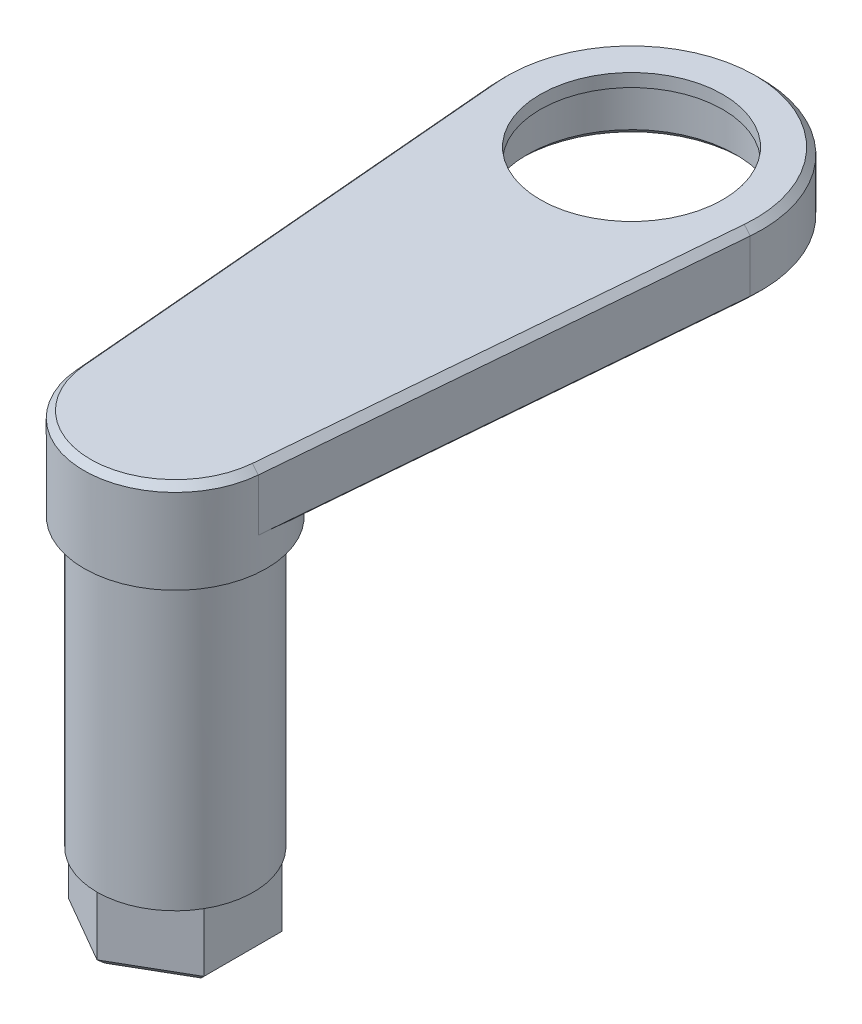
from build123d import *

# Parameters (mm, degrees)
BOSS_EXTRUDE3_DEPTH = 5
BOSS_EXTRUDE1_START = 5
SKETCH2_R           = 8
BOSS_EXTRUDE1_DEPTH = 5
SKETCH3_R           = 8
SKETCH3_R_2         = 7
BOSS_EXTRUDE2_DEPTH = 1
CHAMFER1_SIZE       = 0.5


with BuildPart() as part:
    # Sketch1 → Revolve1 (revolve)
    with BuildSketch(Plane.XY, mode=Mode.PRIVATE) as revolve1_sk:
        Polygon((0, 0), (6, 0), (6, 22), (7, 22), (7, 24), (0, 24), align=None)
    revolve(revolve1_sk.sketch.rotate(Axis((0, 24, 0), (0, -1, 0)), 180), axis=Axis((0, 24, 0), (0, -1, 0)))

    # Sketch4 → Boss-Extrude3 (add)
    with BuildSketch(Plane.XZ):
        Polygon((0, 6), (-5.196152423, 3), (-5.196152423, -3), (0, -6), (5.196152423, -3), (5.196152423, 3), align=None)
    extrude(amount=BOSS_EXTRUDE3_DEPTH)

    # Sketch2 → Boss-Extrude1 (add)
    with BuildSketch(Plane(origin=(0, 24, 0), x_dir=(1, 0, 0), z_dir=(0, 1, 0)).offset(BOSS_EXTRUDE1_START)):
        with BuildLine():
            Line((-6.97423831, -0.6), (-9.963197585, 34.142857143))
            ThreePointArc((-9.963197585, 34.142857143), (0, 45), (9.963197585, 34.142857143))
            Line((9.963197585, 34.142857143), (6.97423831, -0.6))
            ThreePointArc((6.97423831, -0.6), (0, -7), (-6.97423831, -0.6))
        make_face()
        with Locations(Location((0, 35, 0), (0, 0, 180))):
            Circle(SKETCH2_R, mode=Mode.SUBTRACT)
    extrude(amount=-BOSS_EXTRUDE1_DEPTH)

    # Sketch3 → Boss-Extrude2 (add)
    with BuildSketch(Plane(origin=(0, 29, 0), x_dir=(1, 0, 0), z_dir=(0, 1, 0))):
        with Locations(Location((0, 35, 0), (0, 0, 180))):
            Circle(SKETCH3_R)
        with Locations(Location((0, 35, 0), (0, 0, 180))):
            Circle(SKETCH3_R_2, mode=Mode.SUBTRACT)
    extrude(amount=-BOSS_EXTRUDE2_DEPTH)

    # Chamfer1
    # the kernel refuses this chamfer: 0.5 mm, written as the material it takes off along each edge
    with BuildSketch(Plane(origin=(6.309723822, -5, 2.357079253), x_dir=(-0.49981095845564877, -0.027495876610585633, -0.86569797422488), z_dir=(-0.8660254037844385, 0, 0.5000000000000004)), Plane(origin=(-1.113571399, -5, -6.642920747), x_dir=(-0.4998109584556486, -0.0274958766105856, 0.8656979742248803), z_dir=(0.8660254037844386, 0, 0.5000000000000002)), Plane(origin=(5.196152423, -5, -4.285841494), x_dir=(-0.9996219169112968, -0.027495876610585647, 0), z_dir=(0, 0, 1))) as chamfer1_piece_1:
        Polygon((CHAMFER1_SIZE * 0.999621916911, -CHAMFER1_SIZE * 0.0274958766106), (-CHAMFER1_SIZE * 0.0274958766106, -CHAMFER1_SIZE * 0.999621916911), (0, 0), align=None)
    extrude(amount=8.571682988, mode=Mode.SUBTRACT)
    with BuildSketch(Plane(origin=(1.113571399, -5, 6.642920747), x_dir=(-0.013747938305293307, 0.9996219169112968, 0.02381212764409039), z_dir=(-0.8660254037844385, 0, -0.5000000000000004)), Plane(origin=(-5.196152423, -5, 4.285841494), x_dir=(-0.027495876610585647, 0.9996219169112968, 0), z_dir=(0, 0, -1)), Plane(origin=(-6.309723822, -5, -2.357079253), x_dir=(-0.013747938305292924, 0.9996219169112968, -0.023812127644089753), z_dir=(0.8660254037844386, 0, -0.5000000000000001))) as chamfer1_piece_2:
        Polygon((CHAMFER1_SIZE * 0.999621916911, CHAMFER1_SIZE * 0.0274958766106), (-CHAMFER1_SIZE * 0.0274958766106, CHAMFER1_SIZE * 0.999621916911), (0, 0), align=None)
    extrude(amount=8.571682988, mode=Mode.SUBTRACT)
    with BuildSketch(Plane(origin=(0, 24, -35), x_dir=(-1, 0, 0), z_dir=(0, 0, -1))) as chamfer1_piece_3:
        Polygon((8 + CHAMFER1_SIZE, 0), (8, CHAMFER1_SIZE), (8, 0), align=None)
    revolve(axis=Axis((0, 24, -35), (0, 1, 0)), mode=Mode.SUBTRACT)
    with BuildSketch(Plane(origin=(0, 29, 0), x_dir=(0.9963197585235825, 0, 0.08571428571428559), z_dir=(0.08571428571428559, 0, -0.9963197585235825))) as chamfer1_piece_4:
        Polygon((7, CHAMFER1_SIZE), (7 - CHAMFER1_SIZE, 0), (7, 0), align=None)
    revolve(axis=Axis((0, 29, 0), (0, -1, 0)), revolution_arc=170.165799329, mode=Mode.SUBTRACT)
    with BuildSketch(Plane(origin=(9.963197585, 29, -34.142857143), x_dir=(0.027394685145053735, -0.9996219169112968, 0.002356789423764555), z_dir=(-0.08571428571428572, 0, 0.9963197585235826)), Plane(origin=(-6.97423831, 29, 0.6), x_dir=(-0.027394685145053995, -0.9996219169112968, 0.0023567894237645753), z_dir=(-0.08571428571428566, 0, -0.9963197585235826))) as chamfer1_piece_5:
        Polygon((CHAMFER1_SIZE * 0.999621916911, -CHAMFER1_SIZE * 0.0274958766106), (-CHAMFER1_SIZE * 0.0274958766106, -CHAMFER1_SIZE * 0.999621916911), (0, 0), align=None)
    extrude(amount=34.871191548, mode=Mode.SUBTRACT)
    with BuildSketch(Plane(origin=(0, 29, -35), x_dir=(-0.9963197585235826, 0, 0.08571428571428541), z_dir=(0.08571428571428541, 0, 0.9963197585235826))) as chamfer1_piece_6:
        Polygon((10, CHAMFER1_SIZE), (10 - CHAMFER1_SIZE, 0), (10, 0), align=None)
    revolve(axis=Axis((0, 29, -35), (0, -1, 0)), revolution_arc=189.834200671, mode=Mode.SUBTRACT)
    with BuildSketch(Plane(origin=(9.963197585, 24, -34.142857143), x_dir=(-0.9959430668719438, -0.027495876610589047, -0.08568187859239684), z_dir=(-0.08571428571428572, 0, 0.9963197585235826))) as chamfer1_piece_7_section:
        Polygon((CHAMFER1_SIZE * 0.999621916911, -CHAMFER1_SIZE * 0.0274958766106), (-CHAMFER1_SIZE * 0.0274958766106, -CHAMFER1_SIZE * 0.999621916911), (0, 0), align=None)
    chamfer1_piece_7 = extrude(amount=36.157033042, mode=Mode.PRIVATE)
    chamfer1_piece_7 = chamfer1_piece_7 - Plane(origin=(0, 24.16673509, 0), x_dir=(-1, 0, 0), z_dir=(0, 1, 0)) * Cylinder(7, 75, mode=Mode.PRIVATE)
    add(chamfer1_piece_7, mode=Mode.SUBTRACT)
    with BuildSketch(Plane(origin=(0, 24, -35), x_dir=(-0.9963197585235826, 0, 0.08571428571428541), z_dir=(0.08571428571428541, 0, 0.9963197585235826))) as chamfer1_piece_8:
        Polygon((10 - CHAMFER1_SIZE, 0), (10, -CHAMFER1_SIZE), (10, 0), align=None)
    revolve(axis=Axis((0, 24, -35), (0, -1, 0)), revolution_arc=189.834200671, mode=Mode.SUBTRACT)
    with BuildSketch(Plane(origin=(-6.864023324, 24, 1.881109287), x_dir=(0.9959430668719438, -0.02749587661058904, -0.0856818785923968), z_dir=(-0.08571428571428566, 0, -0.9963197585235826))) as chamfer1_piece_9_section:
        Polygon((CHAMFER1_SIZE * 0.999621916911, -CHAMFER1_SIZE * 0.0274958766106), (-CHAMFER1_SIZE * 0.0274958766106, -CHAMFER1_SIZE * 0.999621916911), (0, 0), align=None)
    chamfer1_piece_9 = extrude(amount=36.157033042, mode=Mode.PRIVATE)
    chamfer1_piece_9 = chamfer1_piece_9 - Plane(origin=(0, 24.166735092, 0), x_dir=(-1, 0, 0), z_dir=(0, 1, 0)) * Cylinder(7, 75, mode=Mode.PRIVATE)
    add(chamfer1_piece_9, mode=Mode.SUBTRACT)


solid = part.part
